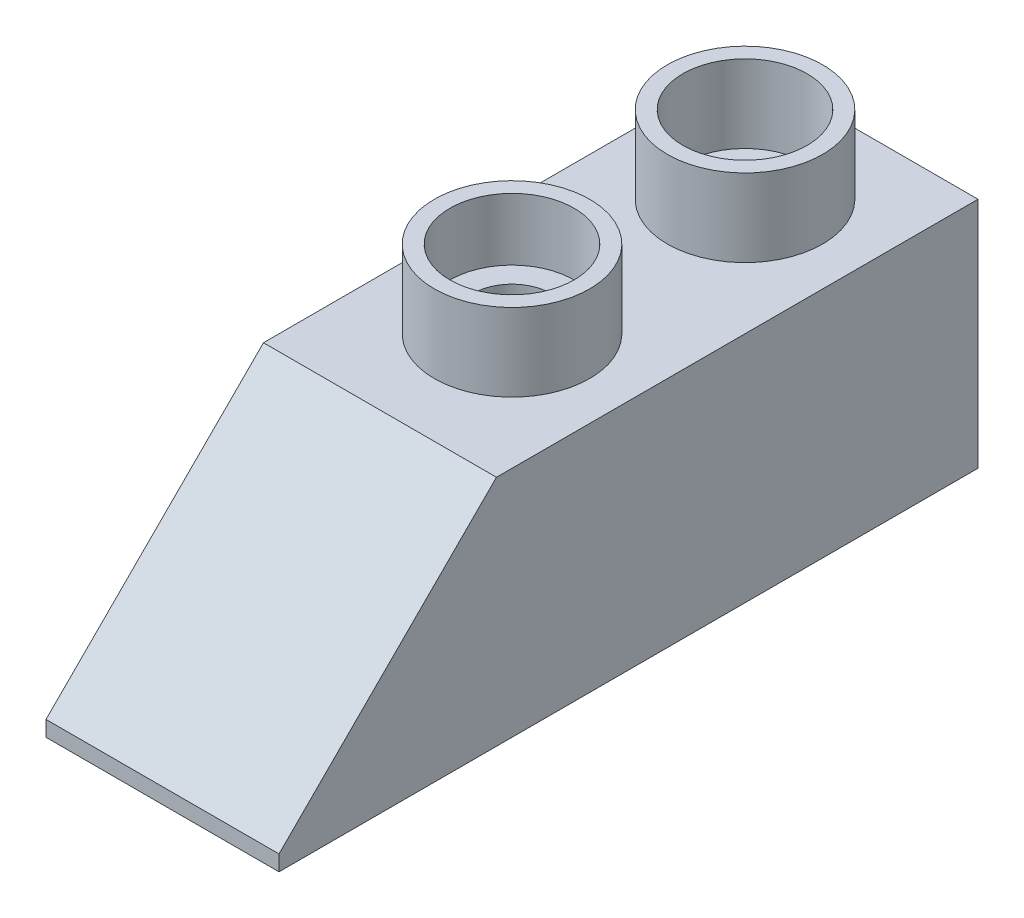
from build123d import *

# Parameters (mm, degrees)
SKETCH1_W                               = 30
SKETCH1_H                               = 90
BOSS_EXTRUDE1_DEPTH                     = 30
SKETCH2_R                               = 10
BOSS_EXTRUDE5_DEPTH                     = 10
SKETCH5_R                               = 8
CUT_EXTRUDE1_DEPTH                      = 10
SKETCH8_R                               = 5
CUT_EXTRUDE3_DEPTH                      = 100.498743711
CBORE_FOR_M5_HEX_HEAD_BOLT1_D           = 10
CBORE_FOR_M5_HEX_HEAD_BOLT1_CBORE_D     = 16
CBORE_FOR_M5_HEX_HEAD_BOLT1_CBORE_DEPTH = 8
CHAMFER2_SIZE                           = 28
SHELL2_OUTLINE_W                        = 24
SHELL2_OUTLINE_H                        = 84
SHELL2_OUTLINE_R                        = 8
SHELL2_DEPTH                            = 0.757359313
SHELL2_START                            = -27
SHELL2_2_DEPTH                          = 24
SHELL2_START_2                          = 0.757359313
SHELL2_3_OUTLINE_R                      = 8
SHELL2_3_OUTLINE_R_2                    = 5
SHELL2_3_DEPTH                          = 26.242640687
FILLET1_R                               = 0.5


with BuildPart() as part:
    # Sketch1 → Boss-Extrude1 (new body)
    with BuildSketch(Plane(origin=(0, 0, 0), x_dir=(1, 0, 0), z_dir=(0, 1, 0))):
        with Locations((-15, -45)):
            Rectangle(SKETCH1_W, SKETCH1_H)
    extrude(amount=BOSS_EXTRUDE1_DEPTH)

    # Sketch2 → Boss-Extrude5 (add)
    with BuildSketch(Plane(origin=(0, 30, 0), x_dir=(1, 0, 0), z_dir=(0, 1, 0))):
        with Locations(Location((-15, -15, 0), (0, 0, 270))):
            Circle(SKETCH2_R)
        with Locations(Location((-15, -45, 0), (0, 0, 270))):
            Circle(SKETCH2_R)
    extrude(amount=BOSS_EXTRUDE5_DEPTH)

    # Sketch5 → Cut-Extrude1 (cut)
    with BuildSketch(Plane(origin=(0, 40, 0), x_dir=(1, 0, 0), z_dir=(0, 1, 0))):
        with Locations(Location((-15, -15, 0), (0, 0, 270))):
            Circle(SKETCH5_R)
    extrude(amount=-CUT_EXTRUDE1_DEPTH, mode=Mode.SUBTRACT)

    # Sketch8 → Cut-Extrude3 (cut, through all)
    with BuildSketch(Plane(origin=(0, 30, 0), x_dir=(1, 0, 0), z_dir=(0, 1, 0))):
        with Locations(Location((-15, -15, 0), (0, 0, 270))):
            Circle(SKETCH8_R)
    extrude(amount=-CUT_EXTRUDE3_DEPTH, mode=Mode.SUBTRACT)

    # CBORE for M5 Hex Head Bolt1 (through all)
    with Locations(Plane(origin=(0, 40, 0), x_dir=(1, 0, 0), z_dir=(0, 1, 0))):
        with Locations((-15, -45)):
            CounterBoreHole(CBORE_FOR_M5_HEX_HEAD_BOLT1_D / 2, CBORE_FOR_M5_HEX_HEAD_BOLT1_CBORE_D / 2, CBORE_FOR_M5_HEX_HEAD_BOLT1_CBORE_DEPTH)

    # Chamfer2
    chamfer2_edges = [part.edges().sort_by_distance(p)[0] for p in [
        (-15, 30, 90),
    ]]
    chamfer(chamfer2_edges, length=CHAMFER2_SIZE)

    # Shell2: read off the stored shape, not the designer's step
    # Shell2 outline → Shell2 (cut)
    with BuildSketch(Plane(origin=(0, 0, 0), x_dir=(1, 0, 0), z_dir=(0, 1, 0))):
        with Locations((-15, -45)):
            Rectangle(SHELL2_OUTLINE_W, SHELL2_OUTLINE_H)
        with Locations((-15, -45)):
            Circle(SHELL2_OUTLINE_R, mode=Mode.SUBTRACT)
        with Locations((-15, -15)):
            Circle(SHELL2_OUTLINE_R, mode=Mode.SUBTRACT)
    extrude(amount=SHELL2_DEPTH, mode=Mode.SUBTRACT)

    # Shell2 2 outline → Shell2 2 (cut)
    with BuildSketch(Plane.YZ.offset(SHELL2_START)):
        Polygon((0.757359313, 3), (27, 3), (27, 60.757359313), (0.757359313, 87), align=None)
    extrude(amount=SHELL2_2_DEPTH, mode=Mode.SUBTRACT)

    # Shell2 3 outline → Shell2 3 (add)
    # profile 1 of 2: a face of its own
    with BuildSketch(Plane(origin=(0, 0, 0), x_dir=(1, 0, 0), z_dir=(0, 1, 0)).offset(SHELL2_START_2)):
        with Locations((-15, -45)):
            Circle(SHELL2_3_OUTLINE_R)
        with Locations((-15, -45)):
            Circle(SHELL2_3_OUTLINE_R_2, mode=Mode.SUBTRACT)
    # profile 2 of 2: a face of its own
    with BuildSketch(Plane(origin=(0, 0, 0), x_dir=(1, 0, 0), z_dir=(0, 1, 0)).offset(SHELL2_START_2)):
        with Locations((-15, -15)):
            Circle(SHELL2_3_OUTLINE_R)
        with Locations((-15, -15)):
            Circle(SHELL2_3_OUTLINE_R_2, mode=Mode.SUBTRACT)
    extrude(amount=SHELL2_3_DEPTH)

    # Fillet1
    fillet1_edges = [part.edges().sort_by_distance(p)[0] for p in [
        (-23, 27, 45),
        (-15, 0, 3),
        (-3, 13.5, 3),
        (-27, 13.878679656, 73.878679656),
        (-27, 13.5, 3),
        (-27, 0, 45),
        (-15, 0.757359313, 87),
        (-27, 0.378679657, 87),
        (-3, 27, 31.878679657),
        (-3, 13.878679656, 73.878679656),
        (-3, 0.378679657, 87),
        (-27, 27, 31.878679657),
        (-15, 27, 60.757359313),
        (-15, 27, 3),
        (-23, 0, 45),
        (-23, 0, 15),
        (-3, 0, 45),
        (-15, 0, 87),
        (-23, 27, 15),
    ]]
    fillet(fillet1_edges, radius=FILLET1_R)


solid = part.part
